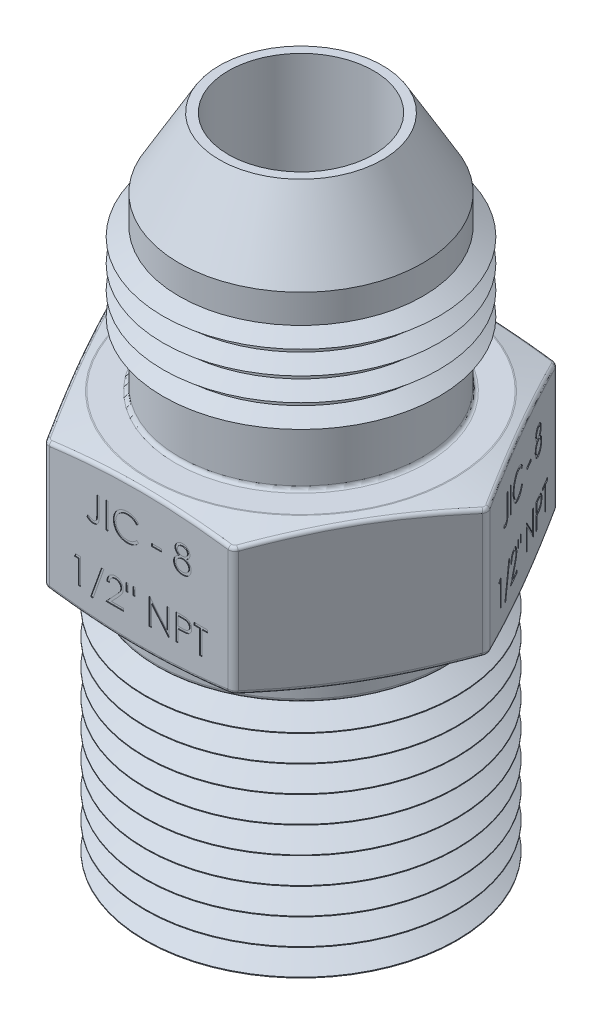
from build123d import *

# Parameters (mm, degrees)
BOSS_EXTRUDE1_DEPTH        = 4.953
SKETCH2_OUTSIDE_W          = 96.354
SKETCH2_OUTSIDE_H          = 92.915
SKETCH2_OUTSIDE_R          = 10.414
CUT_EXTRUDE1_DEPTH         = 8.255
CUT_EXTRUDE1_DRAFT         = -75
SKETCH3_OUTSIDE_W          = 96.354
SKETCH3_OUTSIDE_H          = 92.916
SKETCH3_OUTSIDE_R          = 10.414
CUT_EXTRUDE2_DEPTH         = 8.255
CUT_EXTRUDE2_DRAFT         = -75
FILLET1_R                  = 0.508
FILLET2_R                  = 0.254
SKETCH8_R                  = 8.3439
BOSS_EXTRUDE6_DEPTH        = 16.51
FILLET3_R                  = 0.254
CHAMFER1_SIZE              = 4.7625
CHAMFER1_SIZE2             = 2.749630657
LPATTERN2_COUNT            = 4
LPATTERN2_PITCH            = 1.5875
SKETCH4_R                  = 9.906
BOSS_EXTRUDE7_DEPTH        = 2.032
SKETCH13_R                 = 10.668
BOSS_EXTRUDE8_DEPTH        = 16.256
LPATTERN3_COUNT            = 10
LPATTERN3_PITCH            = 1.814285714
SKETCH15_R                 = 4.9784
CUT_EXTRUDE3_DEPTH         = 44.704
FILLET4_R                  = 0.254
SKETCH_PART_SPECS_INFO_W   = 0.159564103
SKETCH_PART_SPECS_INFO_H   = 1.778
SKETCH_PART_SPECS_INFO_W_2 = 0.683846154
SKETCH_PART_SPECS_INFO_H_2 = 0.182358975
CUT_PART_SPECS_DEPTH       = 0.0508
CIRPATTERN1_COUNT          = 3
CHAMFER2_SIZE              = 0.508


with BuildPart() as part:
    # Sketch1 → Boss-Extrude1 (new, symmetric)
    with BuildSketch(Plane(origin=(0, 0, 0), x_dir=(1, 0, 0), z_dir=(0, 1, 0))):
        Polygon((12.831609733, 0), (6.415804866, 11.1125), (-6.415804866, 11.1125), (-12.831609733, 0), (-6.415804866, -11.1125), (6.415804866, -11.1125), align=None)
    extrude(amount=BOSS_EXTRUDE1_DEPTH, both=True)


with BuildPart() as cut_extrude1_tool:
    # Sketch2 outside → Cut-Extrude1 (with draft: the straight prism first)
    with BuildSketch(Plane(origin=(0, 4.953, 0), x_dir=(1, 0, 0), z_dir=(0, 1, 0))):
        with Locations((0, -0.0005)):
            Rectangle(SKETCH2_OUTSIDE_W, SKETCH2_OUTSIDE_H)
        Circle(SKETCH2_OUTSIDE_R, mode=Mode.SUBTRACT)
    extrude(amount=-CUT_EXTRUDE1_DEPTH)
    # Cut-Extrude1: the draft: its side faces are tilted about the plane it starts from
    cut_extrude1_sides = [cut_extrude1_tool.faces().sort_by_distance(p)[0] for p in [
        (0, 0.8255, 46.458),
        (48.177, 0.8255, 0.0005),
        (0, 0.8255, -46.457),
        (-48.177, 0.8255, 0.0005),
        (-10.414, 0.8255, 0),
    ]]
    draft(cut_extrude1_sides, Plane(origin=(0, 4.953, 0), x_dir=(1, 0, 0), z_dir=(0, 1, 0)), CUT_EXTRUDE1_DRAFT)


with BuildPart() as part_1:
    add(part.part)

    # Cut-Extrude1: cut by cut_extrude1_tool
    add(cut_extrude1_tool.part, mode=Mode.SUBTRACT)


with BuildPart() as cut_extrude2_tool:
    # Sketch3 outside → Cut-Extrude2 (with draft: the straight prism first)
    with BuildSketch(Plane.XZ.offset(4.953)):
        Rectangle(SKETCH3_OUTSIDE_W, SKETCH3_OUTSIDE_H)
        Circle(SKETCH3_OUTSIDE_R, mode=Mode.SUBTRACT)
    extrude(amount=-CUT_EXTRUDE2_DEPTH)
    # Cut-Extrude2: the draft: its side faces are tilted about the plane it starts from
    cut_extrude2_sides = [cut_extrude2_tool.faces().sort_by_distance(p)[0] for p in [
        (0, -0.8255, -46.458),
        (48.177, -0.8255, 0),
        (0, -0.8255, 46.458),
        (-48.177, -0.8255, 0),
        (-10.414, -0.8255, 0),
    ]]
    draft(cut_extrude2_sides, Plane.XZ.offset(4.953), CUT_EXTRUDE2_DRAFT)


with BuildPart() as part_2:
    add(part_1.part)

    # Cut-Extrude2: cut by cut_extrude2_tool
    add(cut_extrude2_tool.part, mode=Mode.SUBTRACT)

    # Fillet1
    # the kernel refuses this fillet: 0.508 mm, written as the material it takes off along each edge
    with BuildSketch(Plane(origin=(6.415804866, 5.038438266, 11.1125), x_dir=(0.49999999999999944, 0, -0.866025403784439), z_dir=(0, -1, 0)), Plane(origin=(-6.415804866, 5.038438266, 11.1125), x_dir=(1, 0, 0), z_dir=(0, -1, 0)), Plane(origin=(-6.415804866, -5.038438266, -11.1125), x_dir=(1, 0, 0), z_dir=(0, 1, 0)), Plane(origin=(6.415804866, -5.038438266, -11.1125), x_dir=(0.5000000000000021, 0, 0.8660254037844375), z_dir=(0, 1, 0)), Plane(origin=(12.831609733, 5.038438266, 0), x_dir=(-0.5000000000000007, 0, -0.8660254037844384), z_dir=(0, -1, 0))) as fillet1_piece_1:
        with BuildLine():
            CenterArc((FILLET1_R * 0.57735026919, -FILLET1_R), FILLET1_R, 90, 60)
            Line((-FILLET1_R * 0.288675134595, -FILLET1_R * 0.5), (0, 0))
            Line((0, 0), (FILLET1_R * 0.57735026919, 0))
        make_face()
    extrude(amount=10.076876533, mode=Mode.SUBTRACT)
    with BuildSketch(Plane(origin=(-12.831609733, -5.038438266, 0), x_dir=(0.5000000000000009, 0, 0.866025403784438), z_dir=(0, 1, 0))) as fillet1_piece_2:
        with BuildLine():
            CenterArc((FILLET1_R * 0.57735026919, FILLET1_R), FILLET1_R, 210, 60)
            Line((-FILLET1_R * 0.288675134595, FILLET1_R * 0.5), (0, 0))
            Line((0, 0), (FILLET1_R * 0.57735026919, 0))
        make_face()
    extrude(amount=10.076876533, mode=Mode.SUBTRACT)

    # Fillet2
    fillet2_edges = [part_2.edges().sort_by_distance(p)[0] for p in [
        (-10.414, 4.953, 0),
        (9.6237073, -4.765837489, 5.55625),
        (9.6237073, 4.765837489, 5.55625),
        (0, -4.765837489, 11.1125),
        (-9.6237073, -4.765837489, 5.55625),
        (-9.6237073, -4.765837489, -5.55625),
        (0, -4.765837489, -11.1125),
        (9.6237073, -4.765837489, -5.55625),
        (12.73563906, -4.330736085, 0.131752657),
        (6.37651093, -4.326260982, -11.044440905),
        (-6.37651093, -4.326260982, -11.044440905),
        (-12.753021859, -4.326260982, 0),
        (-6.37651093, -4.326260982, 11.044440905),
        (6.37651093, -4.326260982, 11.044440905),
        (0, 4.765837489, 11.1125),
        (9.6237073, 4.765837489, -5.55625),
        (0, 4.765837489, -11.1125),
        (-9.6237073, 4.765837489, -5.55625),
        (-9.6237073, 4.765837489, 5.55625),
        (12.73563906, 4.330736085, -0.131752657),
        (6.37651093, 4.326260982, -11.044440905),
        (-6.37651093, 4.326260982, -11.044440905),
        (-12.753021859, 4.326260982, 0),
        (-6.37651093, 4.326260982, 11.044440905),
        (6.37651093, 4.326260982, 11.044440905),
    ]]
    fillet(fillet2_edges, radius=FILLET2_R)

    # Sketch8 → Boss-Extrude6 (add)
    with BuildSketch(Plane(origin=(0, 4.953, 0), x_dir=(1, 0, 0), z_dir=(0, 1, 0))):
        with Locations(Location((0, 0, 0), (0, 0, 270))):
            Circle(SKETCH8_R)
    extrude(amount=BOSS_EXTRUDE6_DEPTH)

    # Fillet3
    fillet3_edges = [part_2.edges().sort_by_distance(p)[0] for p in [
        (0, 4.953, -8.3439),
    ]]
    fillet(fillet3_edges, radius=FILLET3_R)

    # Chamfer1
    chamfer1_edges = [part_2.edges().sort_by_distance(p)[0] for p in [
        (0, 21.463, -8.3439),
    ]]
    chamfer1_side = [part_2.faces().sort_by_distance(p)[0] for p in [
        (0, 13.335, -8.3439),
    ]]
    chamfer(chamfer1_edges, length=CHAMFER1_SIZE, length2=CHAMFER1_SIZE2, reference=chamfer1_side[0])

    # Sketch12 → Revolve2 (revolve)
    with BuildSketch(Plane.XY, mode=Mode.PRIVATE) as revolve2_sk:
        Polygon((8.3439, 14.732), (8.3439, 13.462), (9.443752263, 14.097), align=None)
    revolve2 = revolve(revolve2_sk.sketch.rotate(Axis((0, 0, 0), (0, 1, 0)), 90), axis=Axis((0, 0, 0), (0, 1, 0)))

    # LPattern2: Revolve2 ×4
    with Locations(*[(0, -i * LPATTERN2_PITCH, 0) for i in range(1, LPATTERN2_COUNT)]):
        add(revolve2)

    # Sketch4 → Boss-Extrude7 (add)
    with BuildSketch(Plane.XZ.offset(4.953)):
        with Locations(Location((0, 0, 0), (0, 0, 90))):
            Circle(SKETCH4_R)
    extrude(amount=BOSS_EXTRUDE7_DEPTH)

    # Sketch13 → Boss-Extrude8 (add)
    with BuildSketch(Plane.XZ.offset(6.985)):
        with Locations(Location((0, 0, 0), (0, 0, 90))):
            Circle(SKETCH13_R)
    extrude(amount=BOSS_EXTRUDE8_DEPTH)

    # Sketch14 → Cut-Revolve1 (revolve, cut)
    with BuildSketch(Plane.XY, mode=Mode.PRIVATE) as cut_revolve1_sk:
        Polygon((12.529503233, -22.333857143), (12.529503233, -24.148142857), (10.715217518, -24.148142857), (9.144, -23.241), (10.715217518, -22.333857143), align=None)
    cut_revolve1 = revolve(cut_revolve1_sk.sketch.rotate(Axis((0, 0, 0), (0, -1, 0)), 270), axis=Axis((0, 0, 0), (0, -1, 0)), mode=Mode.SUBTRACT)

    # LPattern3: Cut-Revolve1 ×10
    with Locations(*[(0, i * LPATTERN3_PITCH, 0) for i in range(1, LPATTERN3_COUNT)]):
        add(cut_revolve1, mode=Mode.SUBTRACT)

    # Sketch15 → Cut-Extrude3 (cut)
    with BuildSketch(Plane.XZ.offset(23.241)):
        with Locations(Location((0, 0, 0), (0, 0, 270))):
            Circle(SKETCH15_R)
    extrude(amount=-CUT_EXTRUDE3_DEPTH, mode=Mode.SUBTRACT)

    # Fillet4
    fillet4_edges = [part_2.edges().sort_by_distance(p)[0] for p in [
        (0, -4.953, -9.906),
        (9.906, -6.472487666, 0),
        (-10.414, -4.953, 0),
    ]]
    fillet(fillet4_edges, radius=FILLET4_R)

    # Sketch Part Specs Info → Cut Part Specs (cut)
    # profile 1 of 13: a face of its own
    with BuildSketch(Plane.XY.offset(11.1125)):
        with BuildLine():
            Line((-2.883551282, 2.8981131), (-2.723987179, 2.8981131))
            Line((-2.723987179, 2.8981131), (-2.723987179, 1.697464462))
            add(Edge.make_bspline(
                [(-2.723987179, 1.697464462), (-2.72414665, 1.675262235), (-2.724452853, 1.63263125), (-2.726136574, 1.571227311), (-2.729252381, 1.515159003), (-2.733791367, 1.464298832), (-2.739846845, 1.418806133), (-2.746776488, 1.378329396), (-2.755164989, 1.343206437), (-2.767797154, 1.303767676), (-2.78851032, 1.260514623), (-2.819684775, 1.213801407), (-2.858411036, 1.172941234), (-2.903267961, 1.13745605), (-2.954647601, 1.109182177), (-3.011491896, 1.088884946), (-3.073450923, 1.076504551), (-3.116427323, 1.075197007), (-3.13856891, 1.074523356)],
                knots=[0, 0, 0, 0, 1.237770943, 2.376671248, 3.424123796, 4.367912054, 5.222547132, 5.982086412, 6.656319012, 7.234008312, 8.288027371, 9.317870876, 10.352700517, 11.413286737, 12.494591526, 13.606319346, 14.766767577, 16, 16, 16, 16], degree=3))
            add(Edge.make_bspline(
                [(-3.13856891, 1.074523356), (-3.155819756, 1.075072305), (-3.190529601, 1.076176828), (-3.242188481, 1.085179458), (-3.293700685, 1.099056008), (-3.345339621, 1.119377327), (-3.398125515, 1.147015371), (-3.452773283, 1.183177258), (-3.509985865, 1.227795673), (-3.547670974, 1.261850848), (-3.567397436, 1.279677202)],
                knots=[0, 0, 0, 0, 0.848567217, 1.707373443, 2.573483905, 3.470863513, 4.432650262, 5.500696352, 6.691726801, 8, 8, 8, 8], degree=3))
            Line((-3.567397436, 1.279677202), (-3.47336859, 1.416446433))
            add(Edge.make_bspline(
                [(-3.47336859, 1.416446433), (-3.451675629, 1.401487156), (-3.41071649, 1.37324209), (-3.350516234, 1.336906577), (-3.29717768, 1.305753393), (-3.262286743, 1.289877235), (-3.246132212, 1.282526561)],
                knots=[0, 0, 0, 0, 1.196737151, 2.259595785, 3.194191475, 4, 4, 4, 4], degree=3))
            add(Edge.make_bspline(
                [(-3.246132212, 1.282526561), (-3.236335781, 1.278686357), (-3.2171228, 1.271154861), (-3.18774766, 1.262749545), (-3.158540181, 1.258156), (-3.139176392, 1.257301883), (-3.129664663, 1.25688233)],
                knots=[0, 0, 0, 0, 1.051806502, 2.062826769, 3.048436908, 4, 4, 4, 4], degree=3))
            add(Edge.make_bspline(
                [(-3.129664663, 1.25688233), (-3.117379807, 1.25740188), (-3.093097175, 1.258428837), (-3.057809466, 1.267496269), (-3.024048786, 1.281336426), (-2.9930254, 1.301601203), (-2.964432424, 1.325696365), (-2.940839468, 1.354833217), (-2.921171108, 1.387124737), (-2.909334864, 1.417691836), (-2.90179372, 1.445569164), (-2.897007533, 1.471189197), (-2.892822294, 1.501141628), (-2.889174065, 1.53546221), (-2.887038194, 1.574219654), (-2.88464182, 1.617300159), (-2.883775547, 1.664812338), (-2.883628318, 1.697939502), (-2.883551282, 1.715272955)],
                knots=[0, 0, 0, 0, 0.997221856, 1.971139923, 2.944579524, 3.951425367, 4.971190333, 5.972282193, 6.985401279, 8.033996657, 8.624075553, 9.332086008, 10.151144245, 11.082816738, 12.137127781, 13.306538797, 14.590673636, 16, 16, 16, 16], degree=3))
            Line((-2.883551282, 1.715272955), (-2.883551282, 2.8981131))
        make_face()
    # profile 2 of 13: a face of its own
    with BuildSketch(Plane.XY.offset(11.1125)):
        with Locations((-2.188307693, 2.0091131)):
            Rectangle(SKETCH_PART_SPECS_INFO_W, SKETCH_PART_SPECS_INFO_H)
    # profile 3 of 13: a face of its own
    with BuildSketch(Plane.XY.offset(11.1125)):
        with BuildLine():
            Line((-0.011397436, 2.571861497), (-0.151016026, 2.465010536))
            add(Edge.make_bspline(
                [(-0.151016026, 2.465010536), (-0.160975817, 2.476880448), (-0.18076112, 2.500460241), (-0.212591995, 2.53357145), (-0.245765229, 2.564592603), (-0.280268143, 2.593671478), (-0.316721776, 2.619791195), (-0.354243061, 2.644312915), (-0.393459668, 2.666292926), (-0.44768955, 2.692944123), (-0.518630656, 2.720755169), (-0.607934435, 2.744074011), (-0.701158073, 2.758918368), (-0.764758453, 2.760526108), (-0.797108173, 2.761343869)],
                knots=[0, 0, 0, 0, 0.757959112, 1.505699292, 2.245454638, 2.979532153, 3.711538275, 4.438200793, 5.171680507, 5.909471876, 7.393775596, 8.890124382, 10.418191784, 12, 12, 12, 12], degree=3))
            add(Edge.make_bspline(
                [(-0.797108173, 2.761343869), (-0.814930489, 2.761138656), (-0.850409713, 2.760730135), (-0.903063138, 2.755340699), (-0.954733368, 2.747765804), (-1.005386793, 2.73652614), (-1.054958936, 2.72231605), (-1.103773876, 2.705335939), (-1.151124861, 2.684327681), (-1.197666926, 2.661107885), (-1.242258765, 2.634881143), (-1.284450729, 2.60627396), (-1.324088937, 2.575606459), (-1.361204744, 2.542763697), (-1.395836093, 2.507893581), (-1.427732047, 2.470624495), (-1.456782236, 2.431075591), (-1.483562485, 2.38976838), (-1.507546553, 2.346823182), (-1.527627732, 2.302081046), (-1.545410334, 2.256308162), (-1.559481549, 2.208987372), (-1.570619204, 2.160451647), (-1.578304057, 2.110570727), (-1.5836322, 2.059448818), (-1.58403869, 2.024798487), (-1.58424359, 2.00733225)],
                knots=[0, 0, 0, 0, 1.054917814, 2.100044995, 3.131103042, 4.146048494, 5.169673617, 6.183595914, 7.203665975, 8.234915748, 9.262203917, 10.264457458, 11.251630812, 12.227803204, 13.197192746, 14.159520551, 15.12972552, 16.100847026, 17.073214652, 18.039054194, 19.002613845, 19.979014051, 20.95965708, 21.949030935, 22.966165397, 24, 24, 24, 24], degree=3))
            add(Edge.make_bspline(
                [(-1.58424359, 2.00733225), (-1.583602586, 1.98105274), (-1.582344059, 1.929456407), (-1.571143506, 1.853880936), (-1.554122919, 1.781480434), (-1.528613406, 1.712707474), (-1.497158528, 1.646714028), (-1.457412298, 1.584616691), (-1.411379097, 1.525477076), (-1.358407692, 1.470692859), (-1.300289537, 1.420647886), (-1.237933598, 1.376578591), (-1.17149518, 1.33984263), (-1.101707852, 1.30927325), (-1.028034586, 1.285774832), (-0.950607866, 1.269232257), (-0.869596093, 1.25844123), (-0.814239637, 1.257408116), (-0.786066907, 1.25688233)],
                knots=[0, 0, 0, 0, 1.029171465, 2.020641659, 2.987623507, 3.938342917, 4.889210282, 5.84687017, 6.821220943, 7.821438502, 8.827599549, 9.822697543, 10.807740252, 11.797342354, 12.80366471, 13.83203677, 14.896651826, 16, 16, 16, 16], degree=3))
            add(Edge.make_bspline(
                [(-0.786066907, 1.25688233), (-0.755026741, 1.25774023), (-0.693932269, 1.259428783), (-0.604337312, 1.273733682), (-0.518568743, 1.296927904), (-0.436621949, 1.329388048), (-0.358727948, 1.371585215), (-0.284764845, 1.422739736), (-0.214670207, 1.48333821), (-0.172520796, 1.529608439), (-0.151016026, 1.553215664)],
                knots=[0, 0, 0, 0, 1.028121516, 2.023589091, 2.998037872, 3.967518031, 4.937445131, 5.927275754, 6.942489185, 8, 8, 8, 8], degree=3))
            Line((-0.151016026, 1.553215664), (-0.011397436, 1.447433212))
            add(Edge.make_bspline(
                [(-0.011397436, 1.447433212), (-0.022633436, 1.432935678), (-0.045051616, 1.404010053), (-0.081352288, 1.363232025), (-0.119593155, 1.324875975), (-0.160058256, 1.289251143), (-0.202282094, 1.255644675), (-0.247022829, 1.225011344), (-0.293692297, 1.196923575), (-0.342132373, 1.171205098), (-0.392291588, 1.148387136), (-0.444109841, 1.128852622), (-0.497363773, 1.112025178), (-0.552055819, 1.098181194), (-0.608299424, 1.087375484), (-0.665891625, 1.080151889), (-0.724956721, 1.075202996), (-0.764804963, 1.074751935), (-0.784998397, 1.074523356)],
                knots=[0, 0, 0, 0, 0.986787822, 1.968848986, 2.935600012, 3.899624008, 4.868462664, 5.837806735, 6.815139263, 7.798259679, 8.787526145, 9.778297419, 10.776456485, 11.791383307, 12.812564526, 13.85620153, 14.913611965, 16, 16, 16, 16], degree=3))
            add(Edge.make_bspline(
                [(-0.784998397, 1.074523356), (-0.80412138, 1.074656448), (-0.841934711, 1.074919622), (-0.897763277, 1.079182843), (-0.952113984, 1.084999309), (-1.004831494, 1.093757296), (-1.056203489, 1.10409222), (-1.105764266, 1.117946019), (-1.154001513, 1.133464995), (-1.20072143, 1.151704729), (-1.245963757, 1.172286949), (-1.289582574, 1.195549061), (-1.331557817, 1.221295449), (-1.372302171, 1.248958594), (-1.411213743, 1.279427063), (-1.448629734, 1.312277713), (-1.484759952, 1.347399823), (-1.507113316, 1.372726088), (-1.518352163, 1.385459654)],
                knots=[0, 0, 0, 0, 1.114604814, 2.203992996, 3.262667896, 4.300477797, 5.318619304, 6.316056647, 7.298880507, 8.271930387, 9.238335007, 10.195173496, 11.151986948, 12.108099108, 13.064862484, 14.031167946, 15.010108607, 16, 16, 16, 16], degree=3))
            add(Edge.make_bspline(
                [(-1.518352163, 1.385459654), (-1.53635347, 1.407578578), (-1.572138757, 1.451549387), (-1.617922604, 1.522814665), (-1.657113562, 1.597220516), (-1.68880053, 1.675157839), (-1.713571998, 1.756451752), (-1.730732845, 1.841143233), (-1.74188426, 1.929153188), (-1.743159487, 1.989014277), (-1.743807692, 2.019442026)],
                knots=[0, 0, 0, 0, 0.994628077, 1.977248131, 2.950237994, 3.925870899, 4.908910175, 5.911660606, 6.938484602, 8, 8, 8, 8], degree=3))
            add(Edge.make_bspline(
                [(-1.743807692, 2.019442026), (-1.743017654, 2.051423396), (-1.741463303, 2.114344746), (-1.728257439, 2.206685914), (-1.70701349, 2.295154825), (-1.676839871, 2.379586327), (-1.638584752, 2.460424509), (-1.591327233, 2.537051842), (-1.535616324, 2.609958376), (-1.47188896, 2.678037869), (-1.402004754, 2.740287861), (-1.327166796, 2.795053412), (-1.247521567, 2.84062991), (-1.163946498, 2.878727961), (-1.075815772, 2.908011348), (-0.983317421, 2.928510767), (-0.886625252, 2.941270262), (-0.82065514, 2.942883267), (-0.787135417, 2.943702843)],
                knots=[0, 0, 0, 0, 1.032925535, 2.032216505, 3.007276963, 3.968222605, 4.92396291, 5.891752235, 6.871517503, 7.883894988, 8.900124299, 9.891468569, 10.874487609, 11.85992873, 12.854644235, 13.869047385, 14.917252991, 16, 16, 16, 16], degree=3))
            add(Edge.make_bspline(
                [(-0.787135417, 2.943702843), (-0.766706465, 2.943457917), (-0.726269412, 2.94297311), (-0.666451065, 2.93824559), (-0.608212763, 2.930364678), (-0.551514384, 2.919637715), (-0.496080095, 2.906324395), (-0.442333573, 2.888981124), (-0.38995944, 2.869150566), (-0.33928801, 2.846311665), (-0.290562403, 2.820674561), (-0.243797793, 2.792523424), (-0.199365645, 2.761893155), (-0.15695331, 2.729044261), (-0.117270274, 2.693281793), (-0.079189843, 2.655589415), (-0.044005216, 2.614881432), (-0.022286593, 2.586227725), (-0.011397436, 2.571861497)],
                knots=[0, 0, 0, 0, 1.096760587, 2.17092713, 3.219439832, 4.250915756, 5.268269357, 6.278326846, 7.281116186, 8.274029601, 9.260640565, 10.235837813, 11.203064059, 12.156899882, 13.114053108, 14.069676657, 15.032185724, 16, 16, 16, 16], degree=3))
        make_face()
    # profile 4 of 13: a face of its own
    with BuildSketch(Plane.XY.offset(11.1125)):
        with Locations((1.219525641, 1.803959253)):
            Rectangle(SKETCH_PART_SPECS_INFO_W_2, SKETCH_PART_SPECS_INFO_H_2)
    # profile 5 of 13: a face of its own
    with BuildSketch(Plane.XY.offset(11.1125)):
        with BuildLine():
            add(Edge.make_bspline(
                [(3.246488381, 2.110621513), (3.261041843, 2.103033031), (3.289425955, 2.088232958), (3.329851176, 2.064402258), (3.366795477, 2.039286247), (3.401283882, 2.014071231), (3.432710465, 1.987791552), (3.460723826, 1.960342709), (3.486015937, 1.932409848), (3.508076743, 1.903519969), (3.527480737, 1.873749824), (3.544250901, 1.843021273), (3.55858524, 1.811401659), (3.569945613, 1.77854583), (3.579303883, 1.744936417), (3.585743091, 1.710139442), (3.589206085, 1.674384197), (3.589860802, 1.6502195), (3.590192308, 1.637984093)],
                knots=[0, 0, 0, 0, 1.272397273, 2.481599622, 3.635517121, 4.734568067, 5.792894095, 6.808321871, 7.773003508, 8.711915296, 9.623354172, 10.525449501, 11.423591555, 12.311487226, 13.218079475, 14.126165749, 15.051214107, 16, 16, 16, 16], degree=3))
            add(Edge.make_bspline(
                [(3.590192308, 1.637984093), (3.589800426, 1.620865645), (3.589024745, 1.586981813), (3.582268353, 1.536971188), (3.57215256, 1.488400403), (3.557380168, 1.441280106), (3.538221766, 1.395870304), (3.514611533, 1.352132127), (3.487885041, 1.309348718), (3.466420903, 1.283024462), (3.455560096, 1.269704446)],
                knots=[0, 0, 0, 0, 1.025265484, 2.029385089, 3.018602448, 3.995076438, 4.983346944, 5.966715145, 6.97116228, 8, 8, 8, 8], degree=3))
            add(Edge.make_bspline(
                [(3.455560096, 1.269704446), (3.441419167, 1.254162808), (3.413312053, 1.223271586), (3.365162325, 1.183164575), (3.312319208, 1.149459083), (3.254987176, 1.12199056), (3.19331948, 1.100610944), (3.127329262, 1.085247745), (3.056887872, 1.076447951), (3.008472693, 1.075175924), (2.983635016, 1.074523356)],
                knots=[0, 0, 0, 0, 0.954267603, 1.896743057, 2.838368354, 3.796610408, 4.779680527, 5.799409237, 6.871065594, 8, 8, 8, 8], degree=3))
            add(Edge.make_bspline(
                [(2.983635016, 1.074523356), (2.959752215, 1.075108815), (2.913278709, 1.076248058), (2.845634507, 1.083966829), (2.782579988, 1.097493786), (2.723748524, 1.116007647), (2.669494787, 1.140092043), (2.619973372, 1.170068315), (2.574469794, 1.204729887), (2.534364986, 1.245072239), (2.498760056, 1.288281638), (2.467483485, 1.332859456), (2.441487053, 1.378809762), (2.419476889, 1.425447396), (2.402627533, 1.473426043), (2.39095765, 1.522498849), (2.383546279, 1.572580102), (2.382560182, 1.606378182), (2.382064103, 1.623381128)],
                knots=[0, 0, 0, 0, 1.256902934, 2.445805442, 3.576955095, 4.645999104, 5.686449165, 6.692658513, 7.68621702, 8.689161843, 9.678783111, 10.630372946, 11.551080876, 12.453998257, 13.34127905, 14.221779781, 15.105423033, 16, 16, 16, 16], degree=3))
            add(Edge.make_bspline(
                [(2.382064103, 1.623381128), (2.382357666, 1.635857198), (2.382937851, 1.660514315), (2.386953514, 1.696942654), (2.393409413, 1.73239909), (2.402177217, 1.767014588), (2.414059858, 1.800537138), (2.428406862, 1.833125579), (2.445136294, 1.864816701), (2.464481525, 1.895783813), (2.486986954, 1.925593005), (2.512470088, 1.95475017), (2.541440245, 1.982802879), (2.573575136, 2.010093871), (2.608507522, 2.037107265), (2.647144747, 2.062383176), (2.688462555, 2.087711022), (2.717827701, 2.102853651), (2.732891426, 2.110621513)],
                knots=[0, 0, 0, 0, 0.941657376, 1.861047343, 2.762797495, 3.66048619, 4.553285746, 5.444104102, 6.34607688, 7.256116206, 8.197091036, 9.162375105, 10.176350973, 11.237807142, 12.343728897, 13.50695164, 14.721116704, 16, 16, 16, 16], degree=3))
            add(Edge.make_bspline(
                [(2.732891426, 2.110621513), (2.712271008, 2.121865976), (2.672344106, 2.143638402), (2.61947683, 2.18364178), (2.574066394, 2.22696799), (2.537360997, 2.274531925), (2.508469905, 2.324847738), (2.488648454, 2.377600618), (2.47523904, 2.431812403), (2.473910708, 2.468848751), (2.47324359, 2.487449237)],
                knots=[0, 0, 0, 0, 1.166880483, 2.259407225, 3.286803203, 4.280235371, 5.237608625, 6.161067461, 7.076446754, 8, 8, 8, 8], degree=3))
            add(Edge.make_bspline(
                [(2.47324359, 2.487449237), (2.474074385, 2.506396397), (2.475744429, 2.544483492), (2.489248756, 2.601179403), (2.51125535, 2.656864618), (2.541187216, 2.71126924), (2.578467922, 2.762551949), (2.623195567, 2.80854675), (2.674302042, 2.848836983), (2.731532238, 2.882657679), (2.793120246, 2.910182977), (2.858101434, 2.929171216), (2.925343612, 2.941584763), (2.971113254, 2.942990224), (2.994320112, 2.943702843)],
                knots=[0, 0, 0, 0, 0.888701115, 1.786444228, 2.72001202, 3.692817113, 4.693886446, 5.687152267, 6.695133018, 7.739871481, 8.800368666, 9.853104506, 10.91144658, 12, 12, 12, 12], degree=3))
            add(Edge.make_bspline(
                [(2.994320112, 2.943702843), (3.01692805, 2.942968101), (3.061508328, 2.941519273), (3.127037599, 2.929435539), (3.189737437, 2.909252943), (3.249391622, 2.881873153), (3.304932211, 2.848148587), (3.354006184, 2.807304943), (3.397355136, 2.761513036), (3.433212008, 2.710245877), (3.462758756, 2.656050307), (3.483333214, 2.599346066), (3.496516816, 2.541358344), (3.498179685, 2.502121438), (3.499012821, 2.482462859)],
                knots=[0, 0, 0, 0, 1.072916533, 2.115669174, 3.151510826, 4.193348718, 5.225979165, 6.227137561, 7.216255879, 8.211077061, 9.189680878, 10.138522389, 11.067357538, 12, 12, 12, 12], degree=3))
            add(Edge.make_bspline(
                [(3.499012821, 2.482462859), (3.498284064, 2.463170714), (3.496852827, 2.425282037), (3.484813257, 2.370048965), (3.464537294, 2.318323369), (3.436854259, 2.269518309), (3.400773312, 2.224518909), (3.356776075, 2.182752942), (3.305213324, 2.143877313), (3.266472794, 2.12193864), (3.246488381, 2.110621513)],
                knots=[0, 0, 0, 0, 0.975232327, 1.915300861, 2.843280834, 3.77672583, 4.742871857, 5.749627742, 6.839139064, 8, 8, 8, 8], degree=3))
        make_face()
        with BuildLine():
            add(Edge.make_bspline(
                [(2.985415865, 2.761343869), (2.972944056, 2.761012937), (2.948543744, 2.76036549), (2.912765979, 2.756982902), (2.878744016, 2.750402668), (2.846122389, 2.741645403), (2.815348353, 2.729815105), (2.786003959, 2.71589844), (2.758588627, 2.698978959), (2.732771405, 2.67999947), (2.709530011, 2.659124274), (2.688902899, 2.637374905), (2.671769017, 2.614324205), (2.657219333, 2.590545559), (2.646662322, 2.565333226), (2.638755656, 2.539460188), (2.633410789, 2.512599493), (2.633010287, 2.494242146), (2.632807692, 2.484956048)],
                knots=[0, 0, 0, 0, 1.203892937, 2.355340988, 3.463153438, 4.544400666, 5.610487187, 6.640501085, 7.674077295, 8.714426146, 9.728707835, 10.68524104, 11.601827946, 12.495867327, 13.368432065, 14.231010473, 15.105153427, 16, 16, 16, 16], degree=3))
            add(Edge.make_bspline(
                [(2.632807692, 2.484956048), (2.633156875, 2.475669549), (2.633846909, 2.457318094), (2.639183514, 2.430218394), (2.647137197, 2.403588202), (2.659659733, 2.37806074), (2.674679443, 2.352750473), (2.693217112, 2.328289975), (2.715309539, 2.30459412), (2.740215478, 2.281864452), (2.767348539, 2.26057988), (2.796093233, 2.242102304), (2.8260888, 2.226641776), (2.857027051, 2.213774438), (2.889223303, 2.20377195), (2.922480271, 2.196675878), (2.956803546, 2.192265423), (2.980060081, 2.191738616), (2.991826923, 2.191472074)],
                knots=[0, 0, 0, 0, 0.873023192, 1.725219244, 2.590779336, 3.480155217, 4.391973325, 5.357036234, 6.360879153, 7.436073238, 8.526419356, 9.601555421, 10.645666583, 11.697338044, 12.750135903, 13.812665442, 14.89329948, 16, 16, 16, 16], degree=3))
            add(Edge.make_bspline(
                [(2.991826923, 2.191472074), (3.006939976, 2.19191549), (3.037016811, 2.192797944), (3.081354711, 2.20100274), (3.124464934, 2.213908946), (3.165886698, 2.231567009), (3.204547827, 2.253729962), (3.239010582, 2.280264335), (3.268981003, 2.310557441), (3.294147633, 2.344137681), (3.313659835, 2.379876288), (3.328849954, 2.415741237), (3.337720251, 2.45211517), (3.338877255, 2.476482388), (3.339448718, 2.488517747)],
                knots=[0, 0, 0, 0, 1.076279235, 2.141928126, 3.20205304, 4.278698113, 5.344010996, 6.36967002, 7.368914609, 8.37248503, 9.349703398, 10.264243087, 11.142681841, 12, 12, 12, 12], degree=3))
            add(Edge.make_bspline(
                [(3.339448718, 2.488517747), (3.339178514, 2.496964789), (3.338642198, 2.513730957), (3.334222569, 2.538490047), (3.326919646, 2.562685875), (3.317032402, 2.586518325), (3.304022626, 2.609653017), (3.288597619, 2.632453626), (3.269860292, 2.654407234), (3.248830904, 2.676025452), (3.224982636, 2.696032536), (3.198361449, 2.713626969), (3.169103823, 2.728568446), (3.137209069, 2.740703934), (3.102794647, 2.749818647), (3.066019067, 2.756644312), (3.026575688, 2.760491452), (2.999433375, 2.761053567), (2.985415865, 2.761343869)],
                knots=[0, 0, 0, 0, 0.814439003, 1.616544685, 2.417341072, 3.248991801, 4.09997495, 4.973547432, 5.9003056, 6.880240646, 7.880314356, 8.896779544, 9.951930927, 11.043077905, 12.18215768, 13.381699519, 14.647792085, 16, 16, 16, 16], degree=3))
        make_face(mode=Mode.SUBTRACT)
        with BuildLine():
            add(Edge.make_bspline(
                [(2.995744792, 2.0091131), (2.979932893, 2.00883185), (2.948913805, 2.008280106), (2.903469685, 2.00213864), (2.859856277, 1.993589308), (2.818220629, 1.980619642), (2.778580324, 1.963755825), (2.74072077, 1.943469079), (2.704931596, 1.919488714), (2.671707011, 1.892119393), (2.641367559, 1.862625191), (2.614749223, 1.831402426), (2.592144483, 1.799031379), (2.573941191, 1.765100927), (2.559000031, 1.730329541), (2.549188582, 1.693851282), (2.542898672, 1.656367429), (2.542054055, 1.630886099), (2.541628205, 1.61803858)],
                knots=[0, 0, 0, 0, 1.140299081, 2.23698856, 3.303958914, 4.344563908, 5.37730929, 6.408454204, 7.439741482, 8.480804886, 9.510774543, 10.48932336, 11.43758569, 12.353841022, 13.263987381, 14.161954604, 15.073269652, 16, 16, 16, 16], degree=3))
            add(Edge.make_bspline(
                [(2.541628205, 1.61803858), (2.542320741, 1.60207168), (2.543694715, 1.570393723), (2.554594687, 1.523574883), (2.572087939, 1.478250587), (2.596484749, 1.434790195), (2.626694276, 1.394175541), (2.663842522, 1.358773643), (2.705620867, 1.327317532), (2.753442897, 1.301876621), (2.805679758, 1.281559234), (2.862317556, 1.267560805), (2.922543455, 1.258294149), (2.964128128, 1.257360353), (2.985415865, 1.25688233)],
                knots=[0, 0, 0, 0, 0.898778495, 1.783155532, 2.693654817, 3.627872908, 4.583023416, 5.533784346, 6.509005473, 7.520592997, 8.575161974, 9.658835044, 10.801527049, 12, 12, 12, 12], degree=3))
            add(Edge.make_bspline(
                [(2.985415865, 1.25688233), (3.002053052, 1.257201765), (3.034467628, 1.257824126), (3.08175529, 1.263317788), (3.12638032, 1.272029797), (3.168256182, 1.284701118), (3.207851652, 1.300169706), (3.244495396, 1.320069124), (3.279130088, 1.342701704), (3.310049062, 1.369553647), (3.338209132, 1.398245231), (3.362762445, 1.428618573), (3.384076881, 1.459848194), (3.400805807, 1.49263984), (3.414179544, 1.526364393), (3.423792709, 1.561332832), (3.429724227, 1.597652411), (3.430324122, 1.622289939), (3.430628205, 1.634778564)],
                knots=[0, 0, 0, 0, 1.224942928, 2.386581632, 3.501229538, 4.569074225, 5.605009692, 6.626002462, 7.634866581, 8.645888296, 9.63523824, 10.59253846, 11.518950513, 12.414518923, 13.29783783, 14.186679152, 15.080837789, 16, 16, 16, 16], degree=3))
            add(Edge.make_bspline(
                [(3.430628205, 1.634778564), (3.430168034, 1.646908253), (3.429260657, 1.670825881), (3.423501618, 1.706267277), (3.413384352, 1.740507906), (3.399502035, 1.773959709), (3.381020506, 1.805944888), (3.359255312, 1.837296703), (3.332994699, 1.867144977), (3.303321101, 1.89572155), (3.270982349, 1.922145544), (3.236607439, 1.945520879), (3.200460972, 1.965206954), (3.162619437, 1.981217334), (3.123166859, 1.993809368), (3.082132255, 2.002605894), (3.039467583, 2.008142892), (3.010483709, 2.008786043), (2.995744792, 2.0091131)],
                knots=[0, 0, 0, 0, 0.917430815, 1.809013306, 2.70690318, 3.612392954, 4.541220862, 5.495268465, 6.494511384, 7.542276156, 8.608045339, 9.649016899, 10.681629292, 11.715607085, 12.752076957, 13.808767841, 14.885711793, 16, 16, 16, 16], degree=3))
        make_face(mode=Mode.SUBTRACT)
    # profile 6 of 13: a face of its own
    with BuildSketch(Plane.XY.offset(11.1125)):
        Polygon((-4.317847356, -1.33057089), (-3.989102564, -1.33057089), (-3.989102564, -3.10857089), (-4.148666667, -3.10857089), (-4.148666667, -1.512929864), (-4.422205128, -1.512929864), align=None)
    # profile 7 of 13: a face of its own
    with BuildSketch(Plane.XY.offset(11.1125)):
        Polygon((-2.393461538, -1.284981146), (-3.137144231, -3.35931448), (-3.30525641, -3.35931448), (-2.561573718, -1.284981146), align=None)
    # profile 8 of 13: a face of its own
    with BuildSketch(Plane.XY.offset(11.1125)):
        with BuildLine():
            Line((-2.02874359, -1.877647813), (-2.188307692, -1.877647813))
            add(Edge.make_bspline(
                [(-2.188307692, -1.877647813), (-2.187267739, -1.856479002), (-2.185225297, -1.814904021), (-2.175660526, -1.754287476), (-2.161974561, -1.696347638), (-2.142624102, -1.641549722), (-2.118592513, -1.589409208), (-2.089773659, -1.5401332), (-2.055639183, -1.493909676), (-2.016926162, -1.451167144), (-1.974879693, -1.411955858), (-1.929512276, -1.378094995), (-1.881839002, -1.349485617), (-1.832004508, -1.325568347), (-1.779446541, -1.307615705), (-1.724642049, -1.294295112), (-1.667350248, -1.286280728), (-1.628315517, -1.285419269), (-1.608463141, -1.284981146)],
                knots=[0, 0, 0, 0, 1.10065271, 2.161652631, 3.183658789, 4.190468796, 5.17591951, 6.163126047, 7.15150782, 8.156236427, 9.156009102, 10.134482811, 11.092018607, 12.041330605, 13.001268258, 13.972401359, 14.968799086, 16, 16, 16, 16], degree=3))
            add(Edge.make_bspline(
                [(-1.608463141, -1.284981146), (-1.588967079, -1.285437562), (-1.550658015, -1.286334403), (-1.494746511, -1.294036206), (-1.441519646, -1.306098967), (-1.39108146, -1.323023198), (-1.34383438, -1.345773687), (-1.299423473, -1.373102837), (-1.257320021, -1.404710511), (-1.219419775, -1.441923448), (-1.184617671, -1.48165026), (-1.154593725, -1.524062115), (-1.128882238, -1.567866592), (-1.107450897, -1.613397718), (-1.091674378, -1.661084201), (-1.079696648, -1.71023178), (-1.072926322, -1.761349184), (-1.071887247, -1.795947314), (-1.071358974, -1.813537236)],
                knots=[0, 0, 0, 0, 1.111607364, 2.184268762, 3.212621178, 4.221274766, 5.211760367, 6.196651075, 7.1921475, 8.207485113, 9.220403448, 10.201281604, 11.166441695, 12.114753415, 13.065576456, 14.026450734, 14.996634279, 16, 16, 16, 16], degree=3))
            add(Edge.make_bspline(
                [(-1.071358974, -1.813537236), (-1.072219152, -1.838301136), (-1.073924412, -1.887394365), (-1.088511315, -1.959537915), (-1.111293343, -2.029435372), (-1.138724, -2.085689921), (-1.166396002, -2.131020536), (-1.191332456, -2.168342638), (-1.22052458, -2.208528216), (-1.254397257, -2.251442704), (-1.292249796, -2.297422243), (-1.334425055, -2.346439059), (-1.381223784, -2.397986718), (-1.414070302, -2.433193964), (-1.431090545, -2.451437477)],
                knots=[0, 0, 0, 0, 1.184426356, 2.348067706, 3.509069118, 4.696110526, 5.333549288, 6.050745305, 6.844228056, 7.710549037, 8.667450064, 9.695053472, 10.805634456, 12, 12, 12, 12], degree=3))
            Line((-1.431090545, -2.451437477), (-1.875946715, -2.926211916))
            Line((-1.875946715, -2.926211916), (-1.048564103, -2.926211916))
            Line((-1.048564103, -2.926211916), (-1.048564103, -3.10857089))
            Line((-1.048564103, -3.10857089), (-2.256692308, -3.10857089))
            Line((-2.256692308, -3.10857089), (-1.567147436, -2.372723935))
            add(Edge.make_bspline(
                [(-1.567147436, -2.372723935), (-1.550359109, -2.355198795), (-1.51811217, -2.321536588), (-1.472502621, -2.272391165), (-1.431538015, -2.226798398), (-1.394953179, -2.184844431), (-1.363541759, -2.145915595), (-1.335666665, -2.111272685), (-1.313332145, -2.079393425), (-1.289092724, -2.042441193), (-1.265616021, -1.997324536), (-1.245442144, -1.942189422), (-1.233141001, -1.885431977), (-1.231665345, -1.847076942), (-1.230923077, -1.827784031)],
                knots=[0, 0, 0, 0, 1.329631726, 2.553950428, 3.673215718, 4.687767853, 5.603093632, 6.413772471, 7.123043292, 7.734684054, 8.834405432, 9.900288307, 10.943827018, 12, 12, 12, 12], degree=3))
            add(Edge.make_bspline(
                [(-1.230923077, -1.827784031), (-1.231246034, -1.815652281), (-1.23188252, -1.79174293), (-1.237499831, -1.756688005), (-1.245988768, -1.722873079), (-1.258152959, -1.690194141), (-1.274209183, -1.658979749), (-1.29375366, -1.62919191), (-1.316303812, -1.600393915), (-1.342390257, -1.57339204), (-1.371047309, -1.548661987), (-1.401321188, -1.526754952), (-1.433350641, -1.508447084), (-1.467000623, -1.493438987), (-1.502177321, -1.481665894), (-1.538948772, -1.473508135), (-1.577213372, -1.468386233), (-1.603341588, -1.467693234), (-1.616655048, -1.467340121)],
                knots=[0, 0, 0, 0, 0.991446411, 1.95395049, 2.89581595, 3.838931463, 4.798493298, 5.75982156, 6.748411868, 7.785213223, 8.824556874, 9.840280684, 10.836137867, 11.835679398, 12.848801643, 13.863922112, 14.911575587, 16, 16, 16, 16], degree=3))
            add(Edge.make_bspline(
                [(-1.616655048, -1.467340121), (-1.630559431, -1.467703357), (-1.657865344, -1.468416693), (-1.697956212, -1.473406607), (-1.736201387, -1.482015094), (-1.772697074, -1.493788844), (-1.807505024, -1.508753787), (-1.840455958, -1.527393193), (-1.871475906, -1.549635208), (-1.90062318, -1.57485261), (-1.927478081, -1.602928552), (-1.951073094, -1.634226413), (-1.971689773, -1.66817474), (-1.989677664, -1.704681932), (-2.004285554, -1.744079252), (-2.015447915, -1.786226846), (-2.024280433, -1.830941708), (-2.027231161, -1.861820531), (-2.02874359, -1.877647813)],
                knots=[0, 0, 0, 0, 1.031018746, 2.02475058, 2.990194455, 3.934040569, 4.864654155, 5.795059489, 6.735614925, 7.690564532, 8.649604399, 9.611025574, 10.590972636, 11.591080095, 12.624614302, 13.701020113, 14.821632451, 16, 16, 16, 16], degree=3))
        make_face()
    # profile 9 of 13: a face of its own
    with BuildSketch(Plane.XY.offset(11.1125)):
        Polygon((-0.275675481, -1.832058069), (-0.386444311, -1.832058069), (-0.410307692, -1.284981146), (-0.25074359, -1.284981146), align=None)
    # profile 10 of 13: a face of its own
    with BuildSketch(Plane.XY.offset(11.1125)):
        Polygon((-0.753299279, -1.832058069), (-0.865136619, -1.832058069), (-0.889, -1.284981146), (-0.729435897, -1.284981146), align=None)
    # profile 11 of 13: a face of its own
    with BuildSketch(Plane.XY.offset(11.1125)):
        Polygon((0.706641026, -3.10857089), (0.706641026, -1.33057089), (0.740120994, -1.33057089), (1.914769231, -2.729962316), (1.914769231, -1.33057089), (2.074333333, -1.33057089), (2.074333333, -3.10857089), (2.038004006, -3.10857089), (0.866205128, -1.712384993), (0.866205128, -3.10857089), align=None)
    # profile 12 of 13: a face of its own
    with BuildSketch(Plane.XY.offset(11.1125)):
        with BuildLine():
            Line((2.530230769, -1.33057089), (2.878921074, -1.33057089))
            add(Edge.make_bspline(
                [(2.878921074, -1.33057089), (2.902904214, -1.330597253), (2.948856976, -1.330647767), (3.014752224, -1.332179257), (3.074599568, -1.334224817), (3.128269961, -1.337060419), (3.175928539, -1.340411487), (3.217359647, -1.345111523), (3.252888942, -1.350018953), (3.274177418, -1.355008227), (3.283886218, -1.35728363)],
                knots=[0, 0, 0, 0, 1.415646017, 2.712440637, 3.8905458, 4.950247383, 5.884950622, 6.709939814, 7.411656543, 8, 8, 8, 8], degree=3))
            add(Edge.make_bspline(
                [(3.283886218, -1.35728363), (3.296176533, -1.360647581), (3.320467558, -1.367296215), (3.355469287, -1.380612786), (3.388770641, -1.396402526), (3.420485873, -1.414397887), (3.450225251, -1.435370954), (3.47843248, -1.458471552), (3.50485863, -1.484233029), (3.529355097, -1.512366445), (3.551851774, -1.542399511), (3.571221653, -1.574780564), (3.587440684, -1.608964546), (3.601351386, -1.64492768), (3.611363281, -1.682971965), (3.618905506, -1.722833055), (3.623692709, -1.764506677), (3.62415121, -1.79298509), (3.624384615, -1.807482348)],
                knots=[0, 0, 0, 0, 0.999701418, 1.975846123, 2.934577507, 3.890451536, 4.834027766, 5.787354733, 6.749476667, 7.726910423, 8.712836071, 9.690891519, 10.682875813, 11.679750201, 12.712814741, 13.765529915, 14.8625177, 16, 16, 16, 16], degree=3))
            add(Edge.make_bspline(
                [(3.624384615, -1.807482348), (3.624170532, -1.822101459), (3.623751662, -1.850704736), (3.618724349, -1.892550113), (3.611952612, -1.932539055), (3.601540109, -1.970582896), (3.587902507, -2.006455707), (3.571904545, -2.040705693), (3.552608911, -2.072750166), (3.530437338, -2.102705462), (3.505773128, -2.130599697), (3.478720635, -2.156230733), (3.449389075, -2.179448537), (3.417871663, -2.200305159), (3.38386114, -2.218316949), (3.347873326, -2.23444966), (3.309595416, -2.247998559), (3.283107019, -2.25512583), (3.269639423, -2.258749576)],
                knots=[0, 0, 0, 0, 1.121902311, 2.195077645, 3.232258892, 4.234102512, 5.217864754, 6.176164875, 7.132989551, 8.084763148, 9.034132444, 9.988522005, 10.94243251, 11.903244335, 12.886203696, 13.894208494, 14.929344452, 16, 16, 16, 16], degree=3))
            add(Edge.make_bspline(
                [(3.269639423, -2.258749576), (3.258500337, -2.26111837), (3.234088384, -2.266309721), (3.193883881, -2.272105217), (3.147074025, -2.277051918), (3.093722706, -2.280760896), (3.033877815, -2.283936083), (2.967506976, -2.286459875), (2.894479905, -2.287846641), (2.843542113, -2.287918163), (2.816947516, -2.287955505)],
                knots=[0, 0, 0, 0, 0.601384939, 1.31797006, 2.144135048, 3.087295005, 4.142315834, 5.309527816, 6.595305764, 8, 8, 8, 8], degree=3))
            Line((2.816947516, -2.287955505), (2.689794872, -2.287955505))
            Line((2.689794872, -2.287955505), (2.689794872, -3.10857089))
            Line((2.689794872, -3.10857089), (2.530230769, -3.10857089))
            Line((2.530230769, -3.10857089), (2.530230769, -1.33057089))
        make_face()
        with BuildLine():
            Line((2.689794872, -1.512929864), (2.689794872, -2.105596531))
            Line((2.689794872, -2.105596531), (3.00108734, -2.1095144))
            add(Edge.make_bspline(
                [(3.00108734, -2.1095144), (3.016286662, -2.109522255), (3.04562864, -2.10953742), (3.088014242, -2.107512926), (3.12733816, -2.105175856), (3.163479604, -2.101754007), (3.196454867, -2.096917208), (3.226318931, -2.092034445), (3.252840231, -2.084970521), (3.283878626, -2.075459202), (3.318464966, -2.059237433), (3.356091281, -2.035691689), (3.387978739, -2.005678689), (3.415572433, -1.971933351), (3.437470219, -1.934392593), (3.453500664, -1.894225573), (3.462919571, -1.851844226), (3.464182558, -1.822843451), (3.464820513, -1.808194688)],
                knots=[0, 0, 0, 0, 1.160613943, 2.240541288, 3.23993089, 4.169200891, 5.011653406, 5.7853311, 6.478053781, 7.106038997, 8.262395093, 9.384106736, 10.481365981, 11.59014053, 12.70357646, 13.786202915, 14.881775077, 16, 16, 16, 16], degree=3))
            add(Edge.make_bspline(
                [(3.464820513, -1.808194688), (3.464179088, -1.793900323), (3.462904016, -1.765484895), (3.453426838, -1.723839685), (3.437501386, -1.684095947), (3.415425436, -1.64702562), (3.388632942, -1.613401707), (3.357492876, -1.584193167), (3.322078539, -1.560712542), (3.289135638, -1.545557234), (3.259874235, -1.536303875), (3.234458, -1.529829496), (3.205760737, -1.524660288), (3.173773105, -1.52047462), (3.138743033, -1.516891462), (3.100369569, -1.514460185), (3.058798079, -1.513037046), (3.029938309, -1.512966456), (3.014977965, -1.512929864)],
                knots=[0, 0, 0, 0, 1.120700087, 2.227813068, 3.331159281, 4.466773991, 5.599788987, 6.693661531, 7.80175334, 8.91857717, 9.525282508, 10.207424825, 10.974604443, 11.810962634, 12.737642355, 13.736264703, 14.826523623, 16, 16, 16, 16], degree=3))
            Line((3.014977965, -1.512929864), (2.689794872, -1.512929864))
        make_face(mode=Mode.SUBTRACT)
    # profile 13 of 13: a face of its own
    with BuildSketch(Plane.XY.offset(11.1125)):
        Polygon((3.783948718, -1.512929864), (3.783948718, -1.33057089), (4.718538462, -1.33057089), (4.718538462, -1.512929864), (4.331025641, -1.512929864), (4.331025641, -3.10857089), (4.171461538, -3.10857089), (4.171461538, -1.512929864), align=None)
    cut_part_specs = extrude(amount=-CUT_PART_SPECS_DEPTH, mode=Mode.SUBTRACT)

    # CirPattern1: Cut Part Specs ×3 about axis
    cirpattern1_axis = Axis((0, 0, 0), (0, 1, 0))
    for i in range(1, CIRPATTERN1_COUNT):
        add(cut_part_specs.rotate(cirpattern1_axis, i * 360 / CIRPATTERN1_COUNT), mode=Mode.SUBTRACT)

    # Chamfer2
    chamfer2_edges = [part_2.edges().sort_by_distance(p)[0] for p in [
        (0, -23.241, 4.9784),
    ]]
    chamfer(chamfer2_edges, length=CHAMFER2_SIZE)


solid = part_2.part
